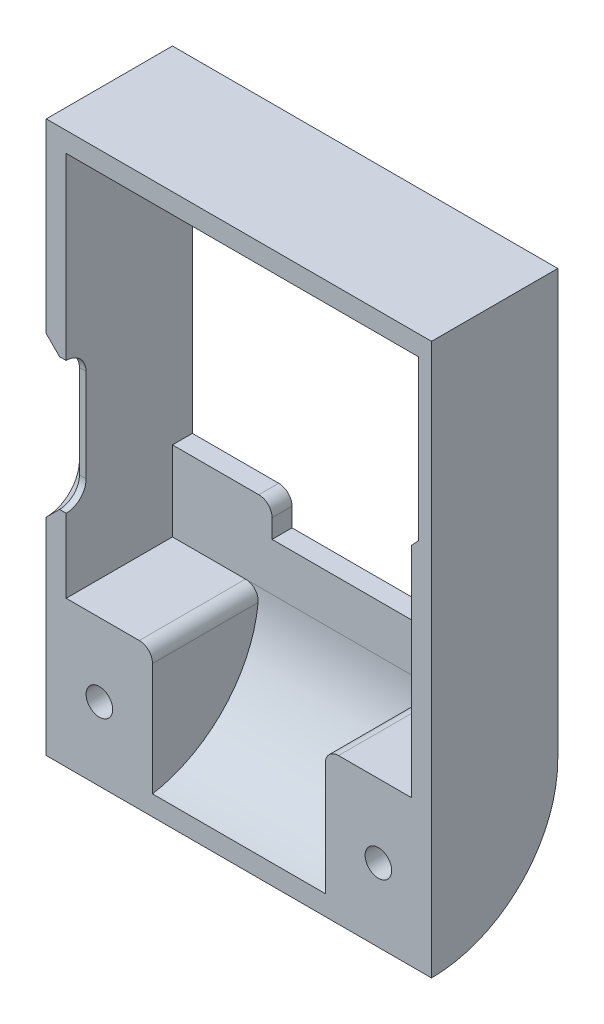
from build123d import *

# Parameters (mm, degrees)
SKETCH_1_W           = 29
SKETCH_1_H           = 32
EXTRUDE_1_DEPTH      = 2
SKETCH_3_W           = 29
SKETCH_3_H           = 32
SKETCH_3_W_2         = 26
SKETCH_3_H_2         = 29
EXTRUDE_1_2_DEPTH    = 7.5
SKETCH_4_W           = 26
SKETCH_4_H           = 29
CUT_EXTRUDE_1_DEPTH  = 0.5
SKETCH_5_W           = 10
SKETCH_5_H           = 2
CUT_EXTRUDE_2_DEPTH  = 74.869338639
SKETCH_10_W          = 0.5
SKETCH_10_H          = 17.5
CUT_EXTRUDE_3_DEPTH  = 74.869338639
SKETCH_11_W          = 9.999080609
SKETCH_11_H          = 1
CUT_EXTRUDE_4_DEPTH  = 74.869338639
SKETCH_12_W          = 29
SKETCH_12_H          = 9.5
EXTRUDE_2_DEPTH      = 9.5
CUT_EXTRUDE_5_DEPTH  = 48.371648808
CUT_EXTRUDE_7_DEPTH  = 3
SKETCH_17_W          = 9.999080609
SKETCH_17_H          = 0.5
EXTRUDE_3_DEPTH      = 3
SKETCH_18_R          = 1
CUT_EXTRUDE_10_DEPTH = 1
SKETCH_19_R          = 1
CUT_EXTRUDE_11_DEPTH = 5
CUT_EXTRUDE_12_REACH = 49.372
CHAMFER_START        = -55.080884848
CHAMFER_2_3_DEPTH    = 1.767766953
CHAMFER_START_2      = -53.313117895
CHAMFER_2_4_DEPTH    = 0.35355339
CUT_EXTRUDE_START    = -8
CUT_EXTRUDE_13_DEPTH = 13
FILLET_2_R           = 1
FILLET_3_R           = 1


with BuildPart() as part:
    # 草图1 → Extrude 1 (new body)
    with BuildSketch(Plane.XY):
        with Locations((-53.89613438, -10.732900943)):
            Rectangle(SKETCH_1_W, SKETCH_1_H)
    extrude(amount=EXTRUDE_1_DEPTH)

    # 草图3 → Extrude 1 2 (add)
    with BuildSketch(Plane.XY.offset(2)):
        with Locations((-53.89613438, -10.732900943)):
            Rectangle(SKETCH_3_W, SKETCH_3_H)
        with Locations((-53.89613438, -10.732900943)):
            Rectangle(SKETCH_3_W_2, SKETCH_3_H_2, mode=Mode.SUBTRACT)
    extrude(amount=EXTRUDE_1_2_DEPTH)

    # 草图4 → 切除-拉伸1 (cut)
    with BuildSketch(Plane.XY.offset(2)):
        with Locations((-53.89613438, -10.732900943)):
            Rectangle(SKETCH_4_W, SKETCH_4_H)
    extrude(amount=-CUT_EXTRUDE_1_DEPTH, mode=Mode.SUBTRACT)

    # 草图5 → 切除-拉伸2 (cut, through all)
    with BuildSketch(Plane.XY.offset(1.5)):
        Polygon((-66.39613438, -1.232900943), (-41.39613438, -1.232900943), (-41.39613438, -18.732900943), (-48.39613438, -18.732900943), (-48.39613438, -21.643495556), (-59.39613438, -21.643495556), (-59.39613438, -18.732900943), (-66.39613438, -18.732900943), align=None)
        with Locations((-53.89613438, 2.767099057)):
            Rectangle(SKETCH_5_W, SKETCH_5_H)
    extrude(amount=-CUT_EXTRUDE_2_DEPTH, mode=Mode.SUBTRACT)

    # 草图10 → 切除-拉伸3 (cut, through all)
    with BuildSketch(Plane.XY.offset(1.5)):
        Polygon((-59.39613438, -18.732900943), (-66.39613438, -18.732900943), (-66.89613438, -18.732900943), (-66.89613438, -19.232900943), (-59.39613438, -19.232900943), align=None)
        with Locations((-66.64613438, -9.982900943)):
            Rectangle(SKETCH_10_W, SKETCH_10_H)
        with Locations((-41.14613438, -9.982900943)):
            Rectangle(SKETCH_10_W, SKETCH_10_H)
        Polygon((-40.89613438, -18.732900943), (-41.39613438, -18.732900943), (-48.39613438, -18.732900943), (-48.39613438, -19.232900943), (-40.89613438, -19.232900943), align=None)
    extrude(amount=-CUT_EXTRUDE_3_DEPTH, mode=Mode.SUBTRACT)

    # 草图11 → 切除-拉伸4 (cut, through all)
    with BuildSketch(Plane.XY.offset(1.5)):
        with Locations((-53.896594076, 1.267099057)):
            Rectangle(SKETCH_11_W, SKETCH_11_H)
    extrude(amount=-CUT_EXTRUDE_4_DEPTH, mode=Mode.SUBTRACT)

    # 草图12 → 凸台-拉伸2 (add)
    with BuildSketch(Plane.XZ.offset(26.732900943)):
        with Locations((-53.89613438, 4.75)):
            Rectangle(SKETCH_12_W, SKETCH_12_H)
    extrude(amount=EXTRUDE_2_DEPTH)

    # 草图14 → 切除-拉伸5 (cut, through all)
    with BuildSketch(Plane.ZY.offset(68.39613438)):
        with BuildLine():
            Line((0, -36.232900943), (0, -26.731740267))
            ThreePointArc((0, -26.731740267), (2.78241518, -33.449665062), (9.5, -36.232900943))
            Line((9.5, -36.232900943), (0, -36.232900943))
        make_face()
    extrude(amount=-CUT_EXTRUDE_5_DEPTH, mode=Mode.SUBTRACT)

    # 草图16 → 切除-拉伸7 (cut)
    with BuildSketch(Plane.XY.offset(9.5)):
        Polygon((-40.39613438, -8.232900943), (-40.89613438, -8.779563893), (-40.89613438, -8.232900943), (-40.89613438, 3.767099057), (-40.39613438, 3.767099057), align=None)
    extrude(amount=-CUT_EXTRUDE_7_DEPTH, mode=Mode.SUBTRACT)

    # 草图17 → 凸台-拉伸3 (add)
    with BuildSketch(Plane(origin=(0, 0.767099057, 0), x_dir=(1, 0, 0), z_dir=(0, 1, 0))):
        with Locations((-53.896594076, -0.25)):
            Rectangle(SKETCH_17_W, SKETCH_17_H)
    extrude(amount=EXTRUDE_3_DEPTH)

    # 草图18 → 切除-拉伸10 (cut)
    with BuildSketch(Plane.XY.offset(1.5)):
        with Locations((-64.39613438, 1.267099057)):
            Circle(SKETCH_18_R)
    extrude(amount=-CUT_EXTRUDE_10_DEPTH, mode=Mode.SUBTRACT)

    # 草图19 → 切除-拉伸11 (cut)
    with BuildSketch(Plane.XY.offset(9.5)):
        with Locations((-64.39613438, -30.732900943)):
            Circle(SKETCH_19_R)
        with Locations(Location((-43.39613438, -30.732900943, 0), (0, 0, 180))):
            Circle(SKETCH_19_R)
    extrude(amount=-CUT_EXTRUDE_11_DEPTH, mode=Mode.SUBTRACT)

    # 草图15 → 切除-拉伸12 (cut, up to next)
    with BuildSketch(Plane.ZY.offset(68.39613438), mode=Mode.PRIVATE) as cut_extrude_12_sk1:
        with BuildLine():
            Line((8, -11.190789021), (8, -18.190789021))
            ThreePointArc((8, -18.190789021), (8.439339828, -19.251449193), (9.5, -19.690789021))
            Line((9.5, -19.690789021), (9.5, -9.732900943))
            ThreePointArc((9.5, -9.732900943), (8.454122659, -10.157421057), (8, -11.190789021))
        make_face()
    cut_extrude_12_tool1 = extrude(cut_extrude_12_sk1.sketch, amount=-CUT_EXTRUDE_12_REACH, mode=Mode.PRIVATE) & part.part
    add(cut_extrude_12_tool1.solids().sort_by_distance((-68.396134, -14.711699, 8.778661))[0], mode=Mode.SUBTRACT)

    # 倒角2: read off the stored shape, not the designer's step
    # 倒角2 outline → 倒角2 (revolve, cut)
    with BuildSketch(Plane(origin=(0, -11.233509157, 9.5), x_dir=(0, 1, 0), z_dir=(0, 0, -1))):
        Polygon((2.500608213, -68.39613438), (1.500608213, -67.39613438), (1.500608213, -68.39613438), align=None)
    revolve(axis=Axis((0, -11.233509157, 9.5), (1, 0, 0)), mode=Mode.SUBTRACT)

    # Chamfer 2 2 outline → Chamfer 2 2 (revolve, cut)
    with BuildSketch(Plane(origin=(0, -18.190789021, 9.5), x_dir=(0, 1, 0), z_dir=(0, 0, -1))):
        Polygon((2.5, -68.39613438), (1.5, -67.39613438), (1.5, -68.39613438), align=None)
    revolve(axis=Axis((0, -18.190789021, 9.5), (1, 0, 0)), mode=Mode.SUBTRACT)

    # Chamfer 2 3 outline → Chamfer 2 3 (cut)
    with BuildSketch(Plane(origin=(0, 0, 0), x_dir=(0.7071067811865444, 0, 0.7071067811865507), z_dir=(0.7071067811865506, 0, -0.7071067811865446)).offset(CHAMFER_START)):
        with BuildLine():
            Line((-43.413622959, 18.190789021), (-43.413622959, 11.178359935))
            add(Edge.make_bspline(
                [(-43.413622959, 11.178359935), (-43.177918414, 11.180169446), (-42.94221502, 11.182109959), (-42.4708105, 11.186252987), (-42.235109372, 11.188455503), (-41.999409396, 11.190789021)],
                knots=[0, 0, 0, 0, 0.707134144, 0.707134144, 1.414268397, 1.414268397, 1.414268397, 1.414268397], degree=3))
            Line((-41.999409396, 11.190789021), (-41.999409396, 18.190789021))
            Line((-41.999409396, 18.190789021), (-43.413622959, 18.190789021))
        make_face()
    extrude(amount=CHAMFER_2_3_DEPTH, mode=Mode.SUBTRACT)

    # Chamfer 2 4 outline → Chamfer 2 4 (add)
    with BuildSketch(Plane(origin=(0, 0, 0), x_dir=(0.7071067811865444, 0, 0.7071067811865507), z_dir=(0.7071067811865506, 0, -0.7071067811865446)).offset(CHAMFER_START_2)):
        with BuildLine():
            Line((-43.413622959, 18.190789021), (-43.413622959, 11.178359935))
            add(Edge.make_bspline(
                [(-43.413622959, 11.178359935), (-43.177918414, 11.180169446), (-42.94221502, 11.182109959), (-42.4708105, 11.186252987), (-42.235109372, 11.188455503), (-41.999409396, 11.190789021)],
                knots=[0, 0, 0, 0, 0.707134144, 0.707134144, 1.414268397, 1.414268397, 1.414268397, 1.414268397], degree=3))
            Line((-41.999409396, 11.190789021), (-41.999409396, 18.190789021))
            Line((-41.999409396, 18.190789021), (-43.413622959, 18.190789021))
        make_face()
    extrude(amount=CHAMFER_2_4_DEPTH)

    # 草图21 → 切除-拉伸13 (cut)
    with BuildSketch(Plane(origin=(-39.39613438, 0, 0), x_dir=(0, 0, -1), z_dir=(1, 0, 0)).offset(CUT_EXTRUDE_START)):
        with BuildLine():
            Line((-9.5, -34.732900943), (-9.5, -25.232900943))
            Line((-9.5, -25.232900943), (-1.5, -25.232900943))
            ThreePointArc((-1.5, -25.232900943), (-3.766402981, -31.442772118), (-9.5, -34.732900943))
        make_face()
    extrude(amount=-CUT_EXTRUDE_13_DEPTH, mode=Mode.SUBTRACT)

    # 圆角2
    fillet_2_edges = [part.edges().sort_by_distance(p)[0] for p in [
        (-59.39613438, -19.232900943, 0.75),
        (-48.39613438, -19.232900943, 0.75),
    ]]
    fillet(fillet_2_edges, radius=FILLET_2_R)

    # 圆角3
    fillet_3_edges = [part.edges().sort_by_distance(p)[0] for p in [
        (-47.39613438, -25.232900943, 5.5),
        (-60.39613438, -25.232900943, 5.5),
    ]]
    fillet(fillet_3_edges, radius=FILLET_3_R)


solid = part.part
